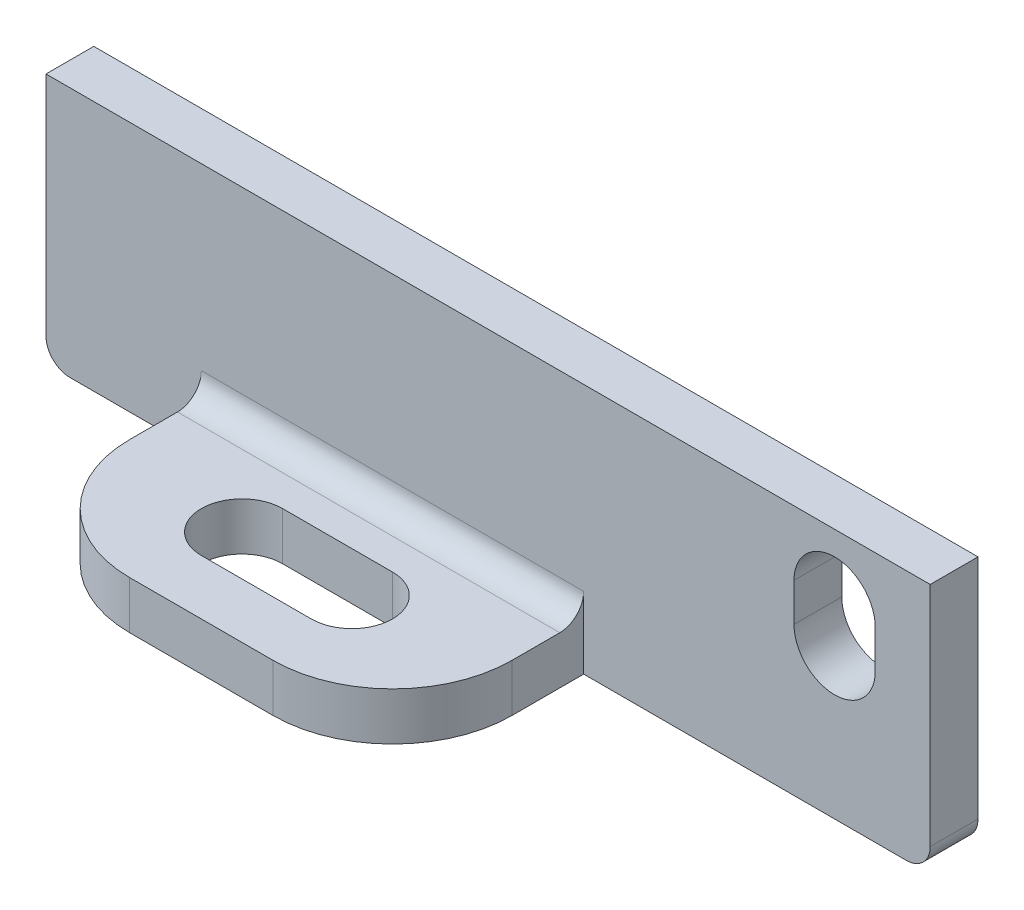
from build123d import *

# Parameters (mm, degrees)
SKETCH_1_W             = 45
SKETCH_1_H             = 10
EXTRUDE_1_DEPTH        = 2
SKETCH_2_W             = 45
SKETCH_2_H             = 23
EXTRUDE_2_DEPTH        = 2
SKETCH_4_W             = 45
SKETCH_4_H             = 2
EXTRUDE_3_DEPTH        = 10
HOLE_START             = -18
HOLE_WIZARD_M3_9_DEPTH = 2
HOLE_WIZARD_M3_1_DEPTH = 2
SKETCH_9_W             = 8
SKETCH_9_H             = 2
CUT_EXTRUDE_1_DEPTH    = 30.904013109
FILLET_2_R             = 3
SKETCH_10_W            = 45
SKETCH_10_H            = 7
CUT_EXTRUDE_2_DEPTH    = 10
SKETCH_11_W            = 45
SKETCH_11_H            = 16
EXTRUDE_4_DEPTH        = 2
HOLE_WIZARD_M3_5_DEPTH = 2
SKETCH_14_W            = 12.097238659
SKETCH_14_H            = 15.369634007
CUT_EXTRUDE_3_DEPTH    = 29.324018077
SKETCH_15_W            = 45
SKETCH_15_H            = 3
CUT_EXTRUDE_4_DEPTH    = 10
FILLET_8_R             = 5
FILLET_9_R             = 1
CUT_EXTRUDE_6_REACH    = 31.904
SKETCH_21_W            = 8
SKETCH_21_H            = 13
FILLET_10_R            = 1
CUT_EXTRUDE_8_REACH    = 31.904
SKETCH_23_W            = 44.634703277
SKETCH_23_H            = 2.5


# Read off the part's stored shape, not the designer's step: M3 间隙槽口9, M3 间隙槽口1, M3 间隙槽口5
with BuildPart() as part:
    # 草图1 → 凸台-拉伸1 (new body)
    with BuildSketch(Plane.XY):
        Rectangle(SKETCH_1_W, SKETCH_1_H)
    extrude(amount=EXTRUDE_1_DEPTH)

    # 草图2 → 凸台-拉伸2 (add)
    with BuildSketch(Plane.XY):
        with Locations((0, -6.5)):
            Rectangle(SKETCH_2_W, SKETCH_2_H)
    extrude(amount=EXTRUDE_2_DEPTH)

    # 草图4 → 凸台-拉伸3 (add)
    with BuildSketch(Plane.XY):
        with Locations((0, -17)):
            Rectangle(SKETCH_4_W, SKETCH_4_H)
    extrude(amount=EXTRUDE_3_DEPTH)

    # M3 间隙槽口9 outline → M3 间隙槽口9 (cut)
    with BuildSketch(Plane(origin=(0, 0, 0), x_dir=(1, 0, 0), z_dir=(0, 1, 0)).offset(HOLE_START)):
        with BuildLine():
            Line((-2.3, -7.7), (2.3, -7.7))
            ThreePointArc((2.3, -7.7), (4, -6), (2.3, -4.3))
            Line((2.3, -4.3), (-2.3, -4.3))
            ThreePointArc((-2.3, -4.3), (-4, -6), (-2.3, -7.7))
        make_face()
    extrude(amount=HOLE_WIZARD_M3_9_DEPTH, mode=Mode.SUBTRACT)

    # M3 间隙槽口1 outline → M3 间隙槽口1 (cut)
    with BuildSketch(Plane.XY):
        with BuildLine():
            ThreePointArc((20.2, 1.3), (18.5, 3), (16.8, 1.3))
            Line((16.8, 1.3), (16.8, -13.3))
            ThreePointArc((16.8, -13.3), (18.5, -15), (20.2, -13.3))
            Line((20.2, -13.3), (20.2, 1.3))
        make_face()
        with BuildLine():
            ThreePointArc((-16.8, 1.3), (-18.5, 3), (-20.2, 1.3))
            Line((-20.2, 1.3), (-20.2, -13.3))
            ThreePointArc((-20.2, -13.3), (-18.5, -15), (-16.8, -13.3))
            Line((-16.8, -13.3), (-16.8, 1.3))
        make_face()
    extrude(amount=HOLE_WIZARD_M3_1_DEPTH, mode=Mode.SUBTRACT)

    # 草图9 → 切除-拉伸1 (cut, through all)
    with BuildSketch(Plane.XY.offset(2)):
        with Locations((-18.5, -17)):
            Rectangle(SKETCH_9_W, SKETCH_9_H)
        with Locations((18.5, -17)):
            Rectangle(SKETCH_9_W, SKETCH_9_H)
    extrude(amount=CUT_EXTRUDE_1_DEPTH, mode=Mode.SUBTRACT)

    # 圆角2
    fillet_2_edges = [part.edges().sort_by_distance(p)[0] for p in [
        (-14.5, -17, 2),
        (14.5, -17, 2),
    ]]
    fillet(fillet_2_edges, radius=FILLET_2_R)

    # 草图10 → 切除-拉伸2 (cut)
    with BuildSketch(Plane.XY.offset(2)):
        with Locations((0, 1.5)):
            Rectangle(SKETCH_10_W, SKETCH_10_H)
    extrude(amount=-CUT_EXTRUDE_2_DEPTH, mode=Mode.SUBTRACT)

    # 草图11 → 凸台-拉伸4 (add)
    with BuildSketch(Plane.XY.offset(2)):
        with Locations((0, -10)):
            Rectangle(SKETCH_11_W, SKETCH_11_H)
    extrude(amount=-EXTRUDE_4_DEPTH)

    # M3 间隙槽口5 outline → M3 间隙槽口5 (cut)
    with BuildSketch(Plane.XY):
        with BuildLine():
            Line((16.8, -10.2), (16.8, -11.8))
            ThreePointArc((16.8, -11.8), (18.5, -13.5), (20.2, -11.8))
            Line((20.2, -11.8), (20.2, -10.2))
            ThreePointArc((20.2, -10.2), (18.5, -8.5), (16.8, -10.2))
        make_face()
        with BuildLine():
            Line((-20.2, -10.2), (-20.2, -11.8))
            ThreePointArc((-20.2, -11.8), (-18.5, -13.5), (-16.8, -11.8))
            Line((-16.8, -11.8), (-16.8, -10.2))
            ThreePointArc((-16.8, -10.2), (-18.5, -8.5), (-20.2, -10.2))
        make_face()
    extrude(amount=HOLE_WIZARD_M3_5_DEPTH, mode=Mode.SUBTRACT)

    # 草图14 → 切除-拉伸3 (cut, through all)
    with BuildSketch(Plane(origin=(0, -16, 0), x_dir=(1, 0, 0), z_dir=(0, 1, 0))):
        with Locations((-14.04861933, -9.684817004)):
            Rectangle(SKETCH_14_W, SKETCH_14_H)
        with Locations((14.04861933, -9.684817004)):
            Rectangle(SKETCH_14_W, SKETCH_14_H)
    extrude(amount=-CUT_EXTRUDE_3_DEPTH, mode=Mode.SUBTRACT)

    # 草图15 → 切除-拉伸4 (cut)
    with BuildSketch(Plane.XY.offset(2)):
        with Locations((0, -3.5)):
            Rectangle(SKETCH_15_W, SKETCH_15_H)
    extrude(amount=-CUT_EXTRUDE_4_DEPTH, mode=Mode.SUBTRACT)

    # 圆角8
    fillet_8_edges = [part.edges().sort_by_distance(p)[0] for p in [
        (8, -17, 10),
        (-8, -17, 10),
    ]]
    fillet(fillet_8_edges, radius=FILLET_8_R)

    # 圆角9
    fillet_9_edges = [part.edges().sort_by_distance(p)[0] for p in [
        (0, -16, 2),
    ]]
    fillet(fillet_9_edges, radius=FILLET_9_R)

    # 草图21 → 切除-拉伸6 (cut, up to next)
    with BuildSketch(Plane.XY.offset(2), mode=Mode.PRIVATE) as cut_extrude_6_sk1:
        with Locations((-18.5, -11.5)):
            Rectangle(SKETCH_21_W, SKETCH_21_H)
    cut_extrude_6_tool1 = extrude(cut_extrude_6_sk1.sketch, amount=-CUT_EXTRUDE_6_REACH, mode=Mode.PRIVATE) & part.part
    add(cut_extrude_6_tool1.solids().sort_by_distance((-18.5, -11.5, 2))[0], mode=Mode.SUBTRACT)

    # 圆角10
    fillet_10_edges = [part.edges().sort_by_distance(p)[0] for p in [
        (22.5, -18, 1),
        (22.5, -5, 1),
        (-14.5, -5, 1),
        (-14.5, -18, 1),
    ]]
    fillet(fillet_10_edges, radius=FILLET_10_R)

    # 草图23 → 切除-拉伸8 (cut, up to next)
    with BuildSketch(Plane.XY.offset(2), mode=Mode.PRIVATE) as cut_extrude_8_sk1:
        with Locations((0.182648362, -6.25)):
            Rectangle(SKETCH_23_W, SKETCH_23_H)
    cut_extrude_8_tool1 = extrude(cut_extrude_8_sk1.sketch, amount=-CUT_EXTRUDE_8_REACH, mode=Mode.PRIVATE) & part.part
    add(cut_extrude_8_tool1.solids().sort_by_distance((0.182648, -6.25, 2))[0], mode=Mode.SUBTRACT)


solid = part.part
